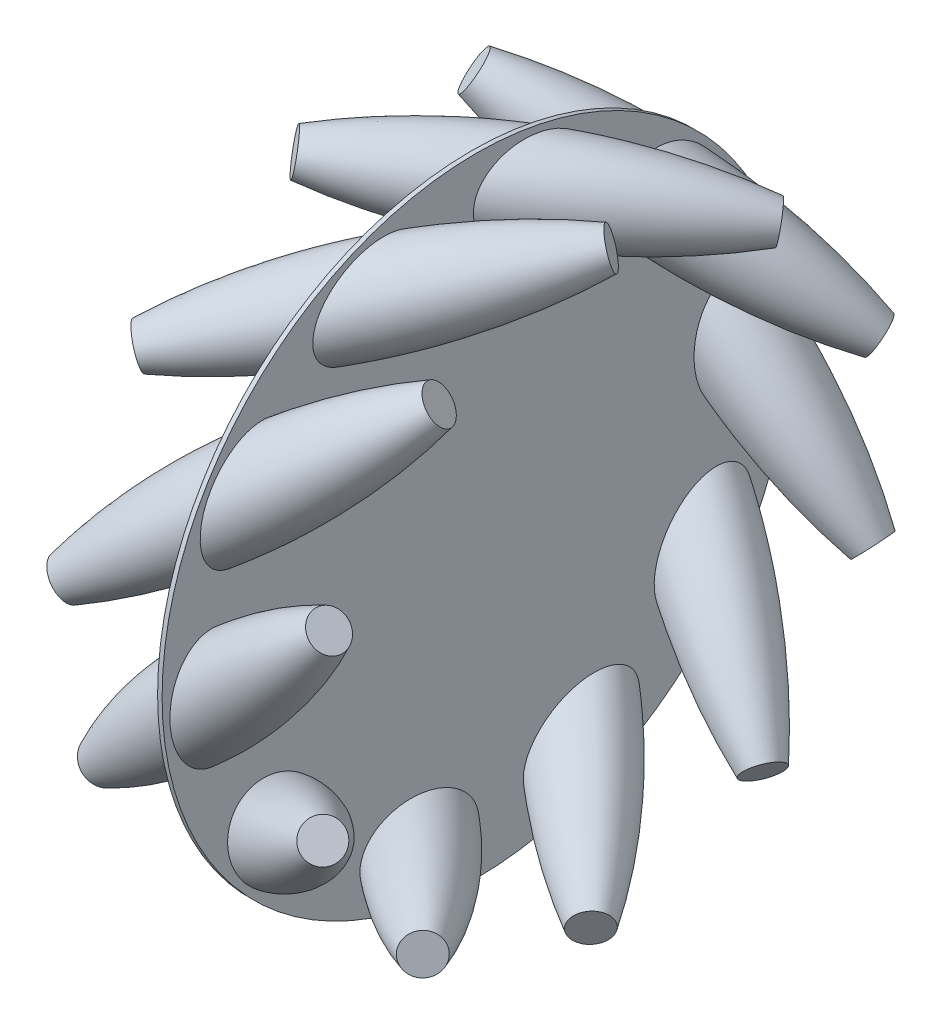
from build123d import *

# Parameters (mm, degrees)
SKETCH_6_R               = 70
EXTRUDE_1_DEPTH          = 0.5
PATTERN_CIRCULAR_2_COUNT = 10


with BuildPart() as part:
    # 草图5 → 旋转1 (revolve)
    with BuildSketch(Plane(origin=(13.19465438, 13.125795331, 1.390430757), x_dir=(0.05281766439045544, 0.05254202441903391, -0.997220953449278), z_dir=(0.7069840571037552, 0.703294513699205, 0.07450080537627188))):
        with BuildLine():
            Line((62.185024099, -54.245593307), (57.84282992, 23.041013906))
            Line((57.84282992, 23.041013906), (62.361394628, 23.29488047))
            add(Edge.make_bspline(
                [(66.350093731, -54.011587161), (75.720907305, -14.770019953), (62.361394628, 23.29488047)],
                knots=[1.169266187, 1.169266187, 1.169266187, 1.972778049, 1.972778049, 1.972778049], degree=2, weights=[1, 0.920375783, 1]))
            Line((66.350093731, -54.011587161), (62.185024099, -54.245593307))
        make_face()
    revolve_1 = revolve(axis=Axis((54.736068112, -22.064522837, -60.621778265), (-0.7071067811865515, 0.7048906770370117, 0.055938657709116456)))

    # 草图6 → 凸台-拉伸1 (add, symmetric)
    with BuildSketch(Plane(origin=(26.398471301, 0, 0), x_dir=(0, 0, -1), z_dir=(1, 0, 0))):
        Circle(SKETCH_6_R)
    extrude(amount=EXTRUDE_1_DEPTH, both=True)

    # 阵列(圆周)2: 旋转1 ×10 about axis
    pattern_circular_2_axis = Axis((0, 0, 0), (1, 0, 0))
    for i in range(1, PATTERN_CIRCULAR_2_COUNT):
        add(revolve_1.rotate(pattern_circular_2_axis, i * 360 / PATTERN_CIRCULAR_2_COUNT))


solid = part.part
